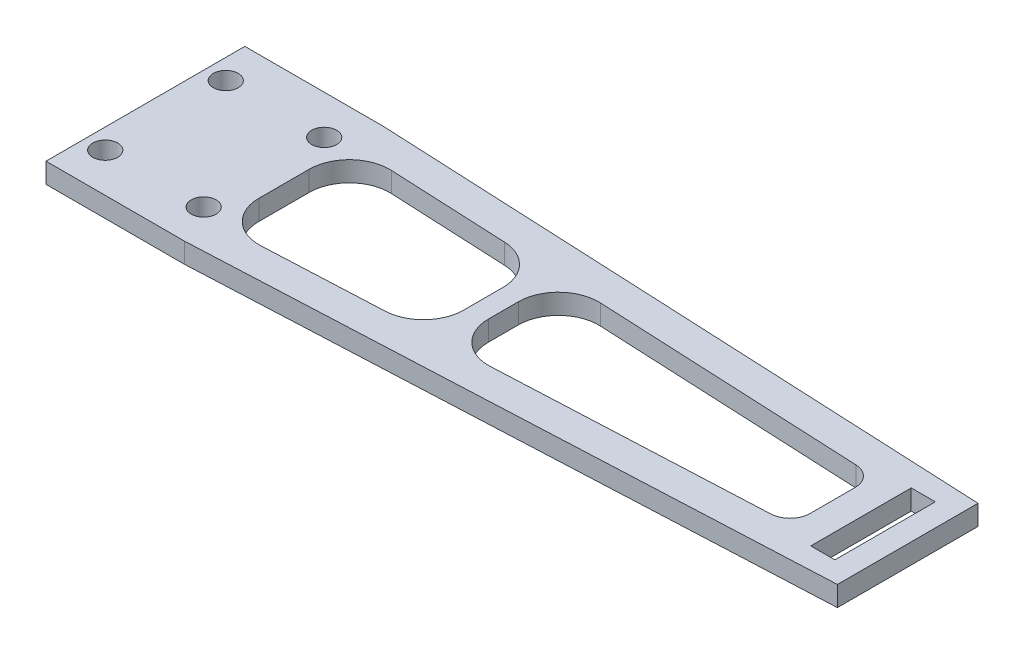
from build123d import *

# Parameters (mm, degrees)
SKETCH1_W           = 34.5
SKETCH1_H           = 49.5
BOSS_EXTRUDE1_DEPTH = 5
SKETCH2_R           = 3.1
CUT_EXTRUDE1_DEPTH  = 5
SKETCH3_W           = 6
SKETCH3_H           = 25
BOSS_EXTRUDE2_DEPTH = 5
FILLET1_R           = 10
FILLET2_R           = 5


with BuildPart() as part:
    # Sketch1 → Boss-Extrude1 (new body)
    with BuildSketch(Plane(origin=(0, 0, 0), x_dir=(1, 0, 0), z_dir=(0, 1, 0))):
        with Locations((17.25, 24.75)):
            Rectangle(SKETCH1_W, SKETCH1_H)
    extrude(amount=BOSS_EXTRUDE1_DEPTH)

    # Sketch2 → Cut-Extrude1 (cut)
    with BuildSketch(Plane(origin=(0, 5, 0), x_dir=(1, 0, 0), z_dir=(0, 1, 0))):
        with Locations((5, 39.75)):
            Circle(SKETCH2_R)
        with Locations((5, 9.75)):
            Circle(SKETCH2_R)
        with Locations((29.5, 9.75)):
            Circle(SKETCH2_R)
        with Locations((29.5, 39.75)):
            Circle(SKETCH2_R)
    extrude(amount=-CUT_EXTRUDE1_DEPTH, mode=Mode.SUBTRACT)

    # Sketch3 → Boss-Extrude2 (add)
    with BuildSketch(Plane(origin=(0, 5, 0), x_dir=(1, 0, 0), z_dir=(0, 1, 0))):
        Polygon((189.75, 42.25), (34.5, 49.5), (34.5, 41.491281612), (84.094915791, 39.175254948), (84.094915791, 10.324745052), (34.5, 8.008718388), (34.5, 0), (189.75, 7.25), align=None)
        Polygon((171.053500921, 14.385612956), (89.094915791, 10.558239416), (89.094915791, 38.941760584), (171.053500921, 35.114387044), align=None, mode=Mode.SUBTRACT)
        with Locations((181.13, 24.75)):
            Rectangle(SKETCH3_W, SKETCH3_H, mode=Mode.SUBTRACT)
    extrude(amount=-BOSS_EXTRUDE2_DEPTH)

    # Fillet1
    fillet1_edges = [part.edges().sort_by_distance(p)[0] for p in [
        (89.094915791, 2.5, -10.558239416),
        (89.094915791, 2.5, -38.941760584),
        (84.094915791, 2.5, -10.324745052),
        (84.094915791, 2.5, -39.175254948),
        (34.5, 2.5, -41.491281612),
        (34.5, 2.5, -8.008718388),
    ]]
    fillet(fillet1_edges, radius=FILLET1_R)

    # Fillet2
    fillet2_edges = [part.edges().sort_by_distance(p)[0] for p in [
        (171.053500921, 2.5, -14.385612956),
        (171.053500921, 2.5, -35.114387044),
    ]]
    fillet(fillet2_edges, radius=FILLET2_R)


solid = part.part
